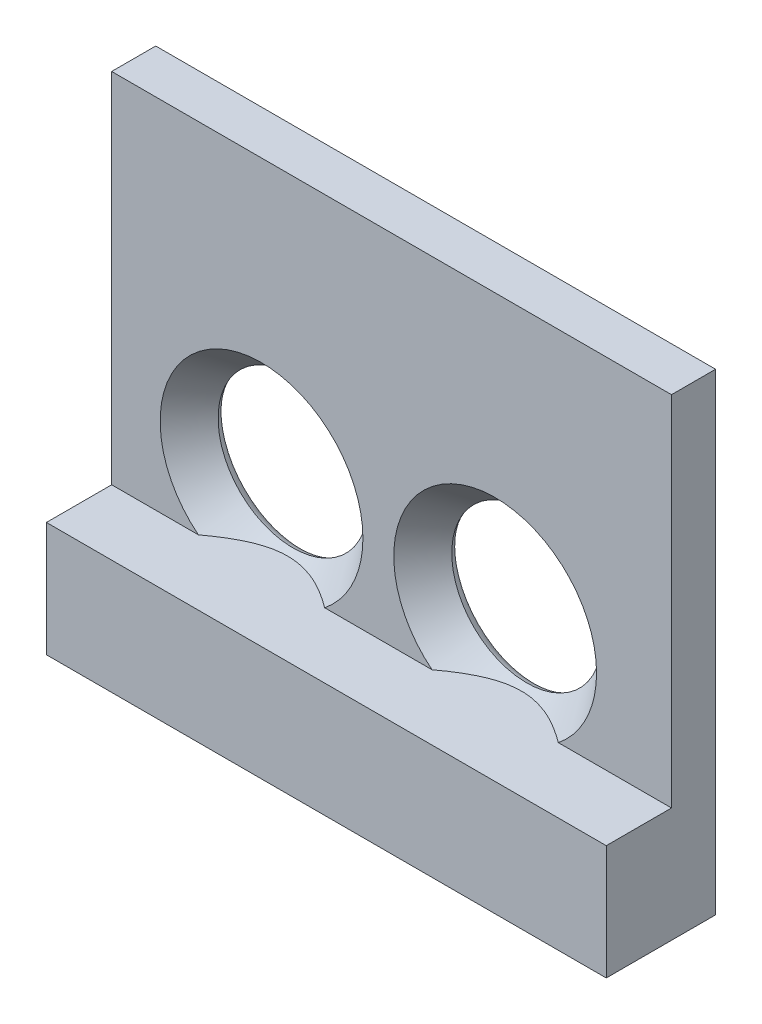
from build123d import *

# Parameters (mm, degrees)
SKICA2_W                 = 63.5
SKICA2_H                 = 53.6
P_IDAT_VYSUNUT_M1_DEPTH  = 5
SKICA3_W                 = 63.5
SKICA3_H                 = 13
P_IDAT_VYSUNUT_M2_DEPTH  = 7.4
SKICA5_R                 = 8.5
ODEBRAT_VYSUNUT_M1_DEPTH = 74
ZKOSEN_1_SIZE            = 3
ZKOSEN_1_SIZE_2          = 3.575260778
ZAOBLIT1_R               = 2


with BuildPart() as part:
    # Skica2 → Přidat vysunutím1 (new body)
    with BuildSketch(Plane.XY):
        with Locations((6.211756064, 35.331333862)):
            Rectangle(SKICA2_W, SKICA2_H)
    extrude(amount=P_IDAT_VYSUNUT_M1_DEPTH)

    # Skica3 → Přidat vysunutím2 (add)
    with BuildSketch(Plane.XY.offset(5)):
        with Locations((6.211756064, 15.031333862)):
            Rectangle(SKICA3_W, SKICA3_H)
    extrude(amount=P_IDAT_VYSUNUT_M2_DEPTH)

    # Skica5 → Odebrat vysunutím1 (cut)
    with BuildSketch(Plane(origin=(0, 0, 0), x_dir=(-1, 0, 0), z_dir=(0, 0, -1))):
        with Locations((-17.961756064, 30.531333862)):
            Circle(SKICA5_R)
        with Locations((8.538243936, 30.531333862)):
            Circle(SKICA5_R)
    extrude(amount=-ODEBRAT_VYSUNUT_M1_DEPTH, mode=Mode.SUBTRACT)

    # Zkosení1
    # the kernel refuses this chamfer: 3.575260778, 3 mm, written as the material it takes off along each edge
    with BuildSketch(Plane(origin=(17.961756064, 30.531333862, 5), x_dir=(-1, 0, 0), z_dir=(0, -1, 0))) as zkosen_1_piece_1_section:
        Polygon((8.5 + ZKOSEN_1_SIZE, 0), (8.5, ZKOSEN_1_SIZE_2), (8.5, 0), align=None)
    zkosen_1_piece_1 = revolve(axis=Axis((17.961756064, 30.531333862, 5), (0, 0, -1)), mode=Mode.PRIVATE)
    zkosen_1_piece_1 = split(zkosen_1_piece_1, bisect_by=Plane(origin=(27.909166998, 21.531333862, 3.256497077), z_dir=(0, 1, 0)), keep=Keep.TOP, mode=Mode.PRIVATE)
    add(zkosen_1_piece_1, mode=Mode.SUBTRACT)
    with BuildSketch(Plane(origin=(-8.538243936, 30.531333862, 5), x_dir=(-1, 0, 0), z_dir=(0, -1, 0))) as zkosen_1_piece_2_section:
        Polygon((8.5 + ZKOSEN_1_SIZE, 0), (8.5, ZKOSEN_1_SIZE_2), (8.5, 0), align=None)
    zkosen_1_piece_2 = revolve(axis=Axis((-8.538243936, 30.531333862, 5), (0, 0, -1)), mode=Mode.PRIVATE)
    zkosen_1_piece_2 = split(zkosen_1_piece_2, bisect_by=Plane(origin=(1.409166998, 21.531333862, 3.256497077), z_dir=(0, 1, 0)), keep=Keep.TOP, mode=Mode.PRIVATE)
    add(zkosen_1_piece_2, mode=Mode.SUBTRACT)

    # Zaoblit1
    # the kernel refuses this fillet: 2 mm, written as the material it takes off along each edge
    with BuildSketch(Plane(origin=(17.961756064, 30.531333862, 0), x_dir=(-1, 0, 0), z_dir=(0, -1, 0))) as zaoblit1_piece_1:
        with BuildLine():
            CenterArc((10.415482978, -2), ZAOBLIT1_R, 90, 73.283856072)
            Line((8.5, -1.424739222), (8.46169034, -1.413234006))
            ThreePointArc((8.46169034, -1.413234006), (8.46, -0.712369611), (8.46, 0))
            Line((8.46, 0), (8.5, 0.04))
            Line((8.5, 0.04), (10.415482978, 0.04))
            Line((10.415482978, 0.04), (10.415482978, 0))
        make_face()
    revolve(axis=Axis((17.961756064, 30.531333862, 0), (0, 0, -1)), mode=Mode.SUBTRACT)
    with BuildSketch(Plane(origin=(-8.538243936, 30.531333862, 0), x_dir=(-1, 0, 0), z_dir=(0, -1, 0))) as zaoblit1_piece_2:
        with BuildLine():
            CenterArc((10.415482978, -2), ZAOBLIT1_R, 90, 73.283856072)
            Line((8.5, -1.424739222), (8.46169034, -1.413234006))
            ThreePointArc((8.46169034, -1.413234006), (8.46, -0.712369611), (8.46, 0))
            Line((8.46, 0), (8.5, 0.04))
            Line((8.5, 0.04), (10.415482978, 0.04))
            Line((10.415482978, 0.04), (10.415482978, 0))
        make_face()
    revolve(axis=Axis((-8.538243936, 30.531333862, 0), (0, 0, -1)), mode=Mode.SUBTRACT)


solid = part.part
